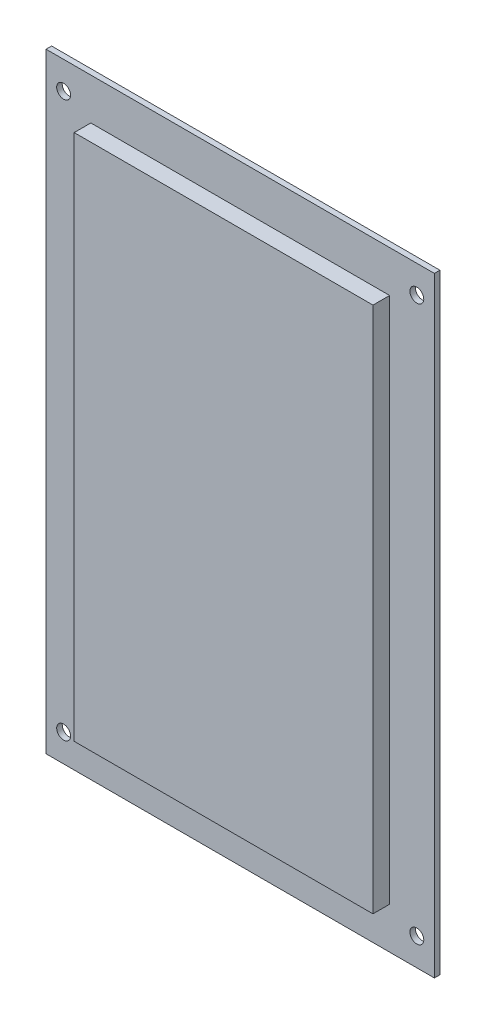
from build123d import *

# Parameters (mm, degrees)
SKETCH2_W           = 53.86
SKETCH2_H           = 95.04
BOSS_EXTRUDE1_DEPTH = 3
SKETCH3_W           = 70
SKETCH3_H           = 110
SKETCH3_R           = 1.25
BOSS_EXTRUDE2_DEPTH = 1


with BuildPart() as part:
    # Sketch2 → Boss-Extrude1 (new body)
    with BuildSketch(Plane.XY):
        with Locations((6.912993197, -3.934965986)):
            Rectangle(SKETCH2_W, SKETCH2_H)
    extrude(amount=BOSS_EXTRUDE1_DEPTH)

    # Sketch3 → Boss-Extrude2 (add)
    with BuildSketch(Plane(origin=(0, 0, 0), x_dir=(-1, 0, 0), z_dir=(0, 0, -1))):
        with Locations((-6.912993197, -3.934965986)):
            Rectangle(SKETCH3_W, SKETCH3_H)
        with Locations((24.922942909, 46.09293361)):
            Circle(SKETCH3_R, mode=Mode.SUBTRACT)
        with Locations((24.922942909, -53.962865582)):
            Circle(SKETCH3_R, mode=Mode.SUBTRACT)
        with Locations((-38.748929304, 46.09293361)):
            Circle(SKETCH3_R, mode=Mode.SUBTRACT)
        with Locations((-38.748929304, -53.962865582)):
            Circle(SKETCH3_R, mode=Mode.SUBTRACT)
    extrude(amount=BOSS_EXTRUDE2_DEPTH)


solid = part.part
